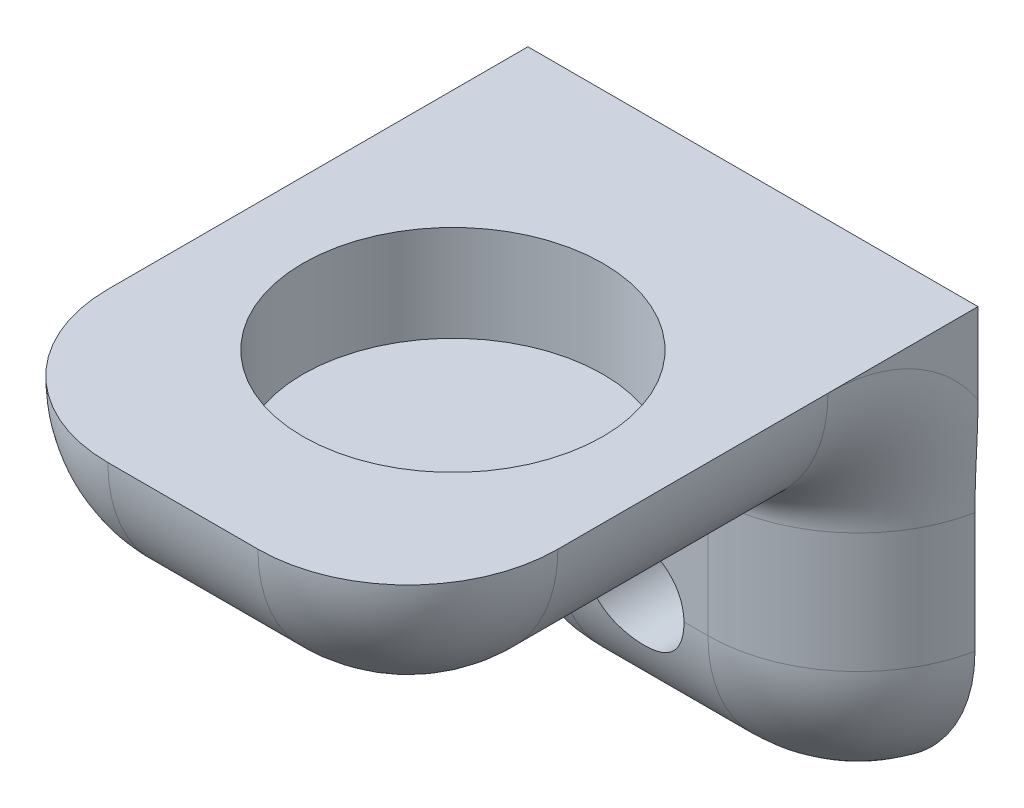
from build123d import *

# Parameters (mm, degrees)
SKETCH1_W           = 15
SKETCH1_H           = 4
BOSS_EXTRUDE1_DEPTH = 15
SKETCH2_W           = 15
SKETCH2_H           = 5
BOSS_EXTRUDE2_DEPTH = 15
FILLET1_R           = 1
FILLET3_R           = 5
SKETCH3_R           = 5
CUT_EXTRUDE1_DEPTH  = 3.2
SKETCH4_R           = 1.6
CUT_EXTRUDE2_DEPTH  = 26.980762229
FILLET4_R           = 5


with BuildPart() as part:
    # Sketch1 → Boss-Extrude1 (new body)
    with BuildSketch(Plane(origin=(0, 0, 0), x_dir=(1, 0, 0), z_dir=(0, 1, 0))):
        with Locations((7.5, 2)):
            Rectangle(SKETCH1_W, SKETCH1_H)
    extrude(amount=BOSS_EXTRUDE1_DEPTH)

    # Sketch2 → Boss-Extrude2 (add)
    with BuildSketch(Plane.XY):
        with Locations((7.5, 12.5)):
            Rectangle(SKETCH2_W, SKETCH2_H)
    extrude(amount=BOSS_EXTRUDE2_DEPTH)

    # Fillet1
    fillet1_edges = [part.edges().sort_by_distance(p)[0] for p in [
        (7.5, 10, 0),
    ]]
    fillet(fillet1_edges, radius=FILLET1_R)

    # Fillet3
    # the kernel refuses this fillet: 5 mm, written as the material it takes off along each edge
    with BuildSketch(Plane(origin=(5, 15, 10), x_dir=(0, -1, 0), z_dir=(-1, 0, 0))) as fillet3_piece_1_section:
        Polygon((0, 0), (FILLET3_R * 1.02, 0), (FILLET3_R * 1.02, FILLET3_R * 1.02), (0, FILLET3_R * 1.02), align=None)
    fillet3_piece_1 = extrude(amount=FILLET3_R * 1.02, mode=Mode.PRIVATE)
    fillet3_piece_1 = fillet3_piece_1 - Plane(origin=(5, 15, 10), x_dir=(0, 0.7071067811865475, -0.7071067811865475), z_dir=(-1, 0, 0)) * Sphere(FILLET3_R, mode=Mode.PRIVATE)
    add(fillet3_piece_1, mode=Mode.SUBTRACT)
    with BuildSketch(Plane(origin=(10, 15, 10), x_dir=(0, -1, 0), z_dir=(1, 0, 0))) as fillet3_piece_2_section:
        Polygon((0, 0), (FILLET3_R * 1.02, 0), (FILLET3_R * 1.02, -FILLET3_R * 1.02), (0, -FILLET3_R * 1.02), align=None)
    fillet3_piece_2 = extrude(amount=FILLET3_R * 1.02, mode=Mode.PRIVATE)
    fillet3_piece_2 = fillet3_piece_2 - Plane(origin=(10, 15, 10), x_dir=(0, 0.7071067811865475, -0.7071067811865475), z_dir=(1, 0, 0)) * Sphere(FILLET3_R, mode=Mode.PRIVATE)
    add(fillet3_piece_2, mode=Mode.SUBTRACT)
    with BuildSketch(Plane(origin=(0, 10, 1), x_dir=(0, 1, 0), z_dir=(0, 0, 1))) as fillet3_piece_3:
        with BuildLine():
            CenterArc((FILLET3_R, -FILLET3_R), FILLET3_R, 90, 90)
            Line((0, -FILLET3_R), (0, 0))
            Line((0, 0), (FILLET3_R, 0))
        make_face()
    extrude(amount=9, mode=Mode.SUBTRACT)
    with BuildSketch(Plane(origin=(15, 10, 1), x_dir=(0, 1, 0), z_dir=(0, 0, 1))) as fillet3_piece_4:
        with BuildLine():
            CenterArc((FILLET3_R, FILLET3_R), FILLET3_R, 180, 90)
            Line((0, FILLET3_R), (0, 0))
            Line((0, 0), (FILLET3_R, 0))
        make_face()
    extrude(amount=9, mode=Mode.SUBTRACT)
    with BuildSketch(Plane(origin=(10, 10, 15), x_dir=(0, 0, -1), z_dir=(-1, 0, 0))) as fillet3_piece_5:
        with BuildLine():
            CenterArc((FILLET3_R, -FILLET3_R), FILLET3_R, 90, 90)
            Line((0, -FILLET3_R), (0, 0))
            Line((0, 0), (FILLET3_R, 0))
        make_face()
    extrude(amount=5, mode=Mode.SUBTRACT)
    with BuildSketch(Plane(origin=(0, -12.5, 0), x_dir=(1, 0, 0), z_dir=(0, 1, 0))) as fillet3_piece_6:
        with BuildLine():
            CenterArc((FILLET3_R, FILLET3_R), FILLET3_R, 180, 90)
            Line((0, FILLET3_R), (0, 0))
            Line((0, 0), (FILLET3_R, 0))
        make_face()
    extrude(amount=21.5, mode=Mode.SUBTRACT)
    with BuildSketch(Plane(origin=(15, -12.5, 0), x_dir=(-1, 0, 0), z_dir=(0, 1, 0))) as fillet3_piece_7:
        with BuildLine():
            CenterArc((FILLET3_R, -FILLET3_R), FILLET3_R, 90, 90)
            Line((0, -FILLET3_R), (0, 0))
            Line((0, 0), (FILLET3_R, 0))
        make_face()
    extrude(amount=21.5, mode=Mode.SUBTRACT)
    with BuildSketch(Plane(origin=(15, 9, 1), x_dir=(0, 0, -1), z_dir=(0, -1, 0))) as fillet3_piece_8:
        with BuildLine():
            CenterArc((1 + FILLET3_R, -FILLET3_R), FILLET3_R, 90, 90)
            Line((1, -FILLET3_R), (1, 0))
            Line((1, 0), (1 + FILLET3_R, 0))
        make_face()
    revolve(axis=Axis((15, 9, 1), (1, 0, 0)), revolution_arc=90, mode=Mode.SUBTRACT)
    with BuildSketch(Plane(origin=(0, 9, 1), x_dir=(0, 0, -1), z_dir=(0, -1, 0))) as fillet3_piece_9:
        with BuildLine():
            CenterArc((1 + FILLET3_R, FILLET3_R), FILLET3_R, 180, 90)
            Line((1 + FILLET3_R, 0), (1, 0))
            Line((1, 0), (1, FILLET3_R))
        make_face()
    revolve(axis=Axis((0, 9, 1), (1, 0, 0)), revolution_arc=90, mode=Mode.SUBTRACT)

    # Sketch3 → Cut-Extrude1 (cut)
    with BuildSketch(Plane(origin=(0, 15, 0), x_dir=(1, 0, 0), z_dir=(0, 1, 0))):
        with Locations(Location((7.5, -6, 0), (0, 0, 270))):
            Circle(SKETCH3_R)
    extrude(amount=-CUT_EXTRUDE1_DEPTH, mode=Mode.SUBTRACT)

    # Sketch4 → Cut-Extrude2 (cut, through all)
    with BuildSketch(Plane.XY):
        with Locations((7.601020514, 5)):
            Circle(SKETCH4_R)
    extrude(amount=-CUT_EXTRUDE2_DEPTH, mode=Mode.SUBTRACT)

    # Fillet4
    # the kernel refuses this fillet: 5 mm, written as the material it takes off along each edge
    with BuildSketch(Plane(origin=(5, 0, -5), x_dir=(0, 0, 1), z_dir=(1, 0, 0))) as fillet4_piece_1:
        with BuildLine():
            CenterArc((5 - FILLET4_R, -FILLET4_R), FILLET4_R, 0, 90)
            Line((5 - FILLET4_R, 0), (5, 0))
            Line((5, 0), (5, -FILLET4_R))
        make_face()
    revolve(axis=Axis((5, 0, -5), (0, -1, 0)), revolution_arc=221.746220733, mode=Mode.SUBTRACT)
    with BuildSketch(Plane(origin=(10, 0, -5), x_dir=(-0.6658324541231062, 0, -0.7461012954260312), z_dir=(-0.7461012954260312, 0, 0.6658324541231062))) as fillet4_piece_2:
        with BuildLine():
            CenterArc((5 - FILLET4_R, -FILLET4_R), FILLET4_R, 0, 90)
            Line((5 - FILLET4_R, 0), (5, 0))
            Line((5, 0), (5, -FILLET4_R))
        make_face()
    revolve(axis=Axis((10, 0, -5), (0, -1, 0)), revolution_arc=221.746220733, mode=Mode.SUBTRACT)
    with BuildSketch(Plane(origin=(5, 0, 0), x_dir=(0, 1, 0), z_dir=(1, 0, 0))) as fillet4_piece_3:
        with BuildLine():
            CenterArc((FILLET4_R, -FILLET4_R), FILLET4_R, 90, 90)
            Line((0, -FILLET4_R), (0, 0))
            Line((0, 0), (FILLET4_R, 0))
        make_face()
    extrude(amount=5, mode=Mode.SUBTRACT)


solid = part.part
